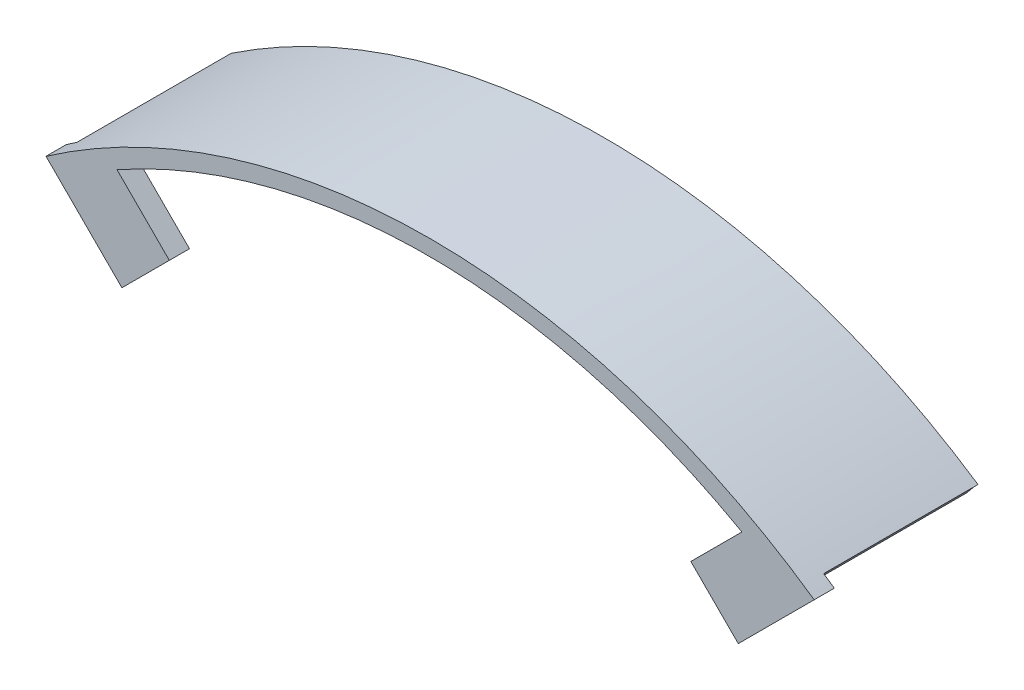
from build123d import *

# Parameters (mm, degrees)
CROQUIS1_R              = 100
SALIENTE_EXTRUIR1_DEPTH = 3
CROQUIS3_R              = 110
CORTAR_EXTRUIR1_DEPTH   = 3
REDONDEO1_R             = 10
CORTAR_EXTRUIR6_DEPTH   = 10
CROQUIS12_R             = 1.5
CORTAR_EXTRUIR7_DEPTH   = 142.453172607
CROQUIS9_R              = 1.5
CROQUIS9_W              = 4.5
CROQUIS9_H              = 8
CROQUIS9_W_2            = 8
CROQUIS9_H_2            = 4.5
CORTAR_EXTRUIR5_DEPTH   = 10
CORTAR_EXTRUIR9_DEPTH   = 142.453172607
SALIENTE_EXTRUIR3_START = -3
SALIENTE_EXTRUIR3_DEPTH = 3
SALIENTE_EXTRUIR4_DEPTH = 23
CORTAR_EXTRUIR10_DEPTH  = 119.122839627
CORTAR_EXTRUIR11_DEPTH  = 23
CORTAR_EXTRUIR14_DEPTH  = 23


with BuildPart() as part:
    # Croquis1 → Saliente-Extruir1 (new body)
    with BuildSketch(Plane.XY):
        Circle(CROQUIS1_R)
    extrude(amount=SALIENTE_EXTRUIR1_DEPTH)

    # Croquis3 → Cortar-Extruir1 (cut)
    with BuildSketch(Plane.XY.offset(3)):
        with Locations((190, 0)):
            Circle(CROQUIS3_R)
    extrude(amount=-CORTAR_EXTRUIR1_DEPTH, mode=Mode.SUBTRACT)

    # Redondeo1
    redondeo1_edges = [part.edges().sort_by_distance(p)[0] for p in [
        (89.473684211, -44.659375654, 1.5),
        (89.473684211, 44.659375654, 1.5),
    ]]
    fillet(redondeo1_edges, radius=REDONDEO1_R)

    # Croquis5 → Cortar-Extruir6 (cut)
    with BuildSketch(Plane.XY.offset(3)):
        Polygon((-58.336309448, -83.085046789), (-83.085046789, -58.336309448), (-65.40737726, -40.658639918), (-40.658639918, -65.40737726), align=None)
        Polygon((-83.085046789, 58.336309448), (-58.336309448, 83.085046789), (-40.658639918, 65.40737726), (-65.40737726, 40.658639918), align=None)
        Polygon((58.336309448, -83.085046789), (83.085046789, -58.336309448), (65.40737726, -40.658639918), (40.658639918, -65.40737726), align=None)
        Polygon((58.336309448, 83.085046789), (83.085046789, 58.336309448), (65.40737726, 40.658639918), (40.658639918, 65.40737726), align=None)
    extrude(amount=-CORTAR_EXTRUIR6_DEPTH, mode=Mode.SUBTRACT)

    # Croquis12 → Cortar-Extruir7 (cut, through all)
    with BuildSketch(Plane.XY.offset(3)):
        with Locations((-63.604254904, -36.804908024)):
            Circle(CROQUIS12_R)
        with Locations((-36.804907897, -63.604255031)):
            Circle(CROQUIS12_R)
        with Locations((-47.666068056, -20.866721176)):
            Circle(CROQUIS12_R)
        with Locations((-20.866721049, -47.666068183)):
            Circle(CROQUIS12_R)
        with Locations((47.666068183, 20.866721049)):
            Circle(CROQUIS12_R)
        with Locations((20.866721176, 47.666068056)):
            Circle(CROQUIS12_R)
        with Locations((63.604255031, 36.804907897)):
            Circle(CROQUIS12_R)
        with Locations((36.804908024, 63.604254904)):
            Circle(CROQUIS12_R)
        with Locations((20.866721325, -47.666067908)):
            Circle(CROQUIS12_R)
        with Locations((47.666068332, -20.866720901)):
            Circle(CROQUIS12_R)
        with Locations((63.60425518, -36.804907749)):
            Circle(CROQUIS12_R)
        with Locations((36.804908173, -63.604254756)):
            Circle(CROQUIS12_R)
        with Locations((-63.604254756, 36.804908173)):
            Circle(CROQUIS12_R)
        with Locations((-36.804907749, 63.60425518)):
            Circle(CROQUIS12_R)
        with Locations((-20.866720901, 47.666068332)):
            Circle(CROQUIS12_R)
        with Locations((-47.666067908, 20.866721325)):
            Circle(CROQUIS12_R)
    extrude(amount=-CORTAR_EXTRUIR7_DEPTH, mode=Mode.SUBTRACT)

    # Croquis9 → Cortar-Extruir5 (cut)
    with BuildSketch(Plane.XY.offset(3)):
        with Locations((71.9, -4)):
            Circle(CROQUIS9_R)
        with Locations((35.959143483, 4)):
            Circle(CROQUIS9_R)
        with Locations((71.959143483, 4)):
            Circle(CROQUIS9_R)
        with Locations((35.9, -4)):
            Circle(CROQUIS9_R)
        with Locations((-91.190074744, 4)):
            Circle(CROQUIS9_R)
        with Locations((-91.190074744, -4)):
            Circle(CROQUIS9_R)
        with Locations((-55.190074744, 4)):
            Circle(CROQUIS9_R)
        with Locations((-55.190074744, -4)):
            Circle(CROQUIS9_R)
        with Locations((-4, 85)):
            Circle(CROQUIS9_R)
        with Locations((4, 85)):
            Circle(CROQUIS9_R)
        with Locations((-4, 49)):
            Circle(CROQUIS9_R)
        with Locations((4, 49)):
            Circle(CROQUIS9_R)
        with Locations((-4, -49)):
            Circle(CROQUIS9_R)
        with Locations((4, -49)):
            Circle(CROQUIS9_R)
        with Locations((4, -85)):
            Circle(CROQUIS9_R)
        with Locations((-4, -85)):
            Circle(CROQUIS9_R)
        with Locations((41.209143483, 0)):
            Rectangle(CROQUIS9_W, CROQUIS9_H)
        with Locations((0, -54.25)):
            Rectangle(CROQUIS9_W_2, CROQUIS9_H_2)
        with Locations((-60.440074744, 0)):
            Rectangle(CROQUIS9_W, CROQUIS9_H)
        with Locations((0, 54.25)):
            Rectangle(CROQUIS9_W_2, CROQUIS9_H_2)
    extrude(amount=-CORTAR_EXTRUIR5_DEPTH, mode=Mode.SUBTRACT)

    # Croquis13 → Cortar-Extruir9 (cut, through all)
    with BuildSketch(Plane.XY.offset(3)):
        with BuildLine():
            Line((-53.709599002, 78.458336343), (-40.658639918, 65.40737726))
            Line((-40.658639918, 65.40737726), (-65.40737726, 40.658639918))
            Line((-65.40737726, 40.658639918), (-81.993870249, 57.245132907))
            ThreePointArc((-81.993870249, 57.245132907), (-100, 0), (-81.993870249, -57.245132907))
            Line((-81.993870249, -57.245132907), (-65.40737726, -40.658639918))
            Line((-65.40737726, -40.658639918), (-40.658639918, -65.40737726))
            Line((-40.658639918, -65.40737726), (-57.245132907, -81.993870249))
            ThreePointArc((-57.245132907, -81.993870249), (0, -100), (57.245132907, -81.993870249))
            Line((57.245132907, -81.993870249), (40.658639918, -65.40737726))
            Line((40.658639918, -65.40737726), (65.40737726, -40.658639918))
            Line((65.40737726, -40.658639918), (81.993870249, -57.245132907))
            ThreePointArc((81.993870249, -57.245132907), (90.456214357, -50.775094972), (87.719298246, -40.480341508))
            ThreePointArc((87.719298246, -40.480341508), (80, 0), (87.719298246, 40.480341508))
            ThreePointArc((87.719298246, 40.480341508), (93.238979947, 51.725451206), (81.993870249, 57.245132907))
            Line((81.993870249, 57.245132907), (65.40737726, 40.658639918))
            Line((65.40737726, 40.658639918), (40.658639918, 65.40737726))
            Line((40.658639918, 65.40737726), (53.489520931, 78.238258273))
            ThreePointArc((53.489520931, 78.238258273), (-0.076031766, 94.913097691), (-53.709599002, 78.458336343))
        make_face()
    extrude(amount=-CORTAR_EXTRUIR9_DEPTH, mode=Mode.SUBTRACT)

    # Croquis14 → Saliente-Extruir3 (add)
    with BuildSketch(Plane(origin=(0, 0, 0), x_dir=(-1, 0, 0), z_dir=(0, 0, -1)).offset(SALIENTE_EXTRUIR3_START)):
        with BuildLine():
            Line((45.931424408, 70.68016175), (38.860356597, 77.751229562))
            Line((38.860356597, 77.751229562), (44.891480587, 83.782353552))
            ThreePointArc((44.891480587, 83.782353552), (49.372752226, 81.239949702), (53.709599002, 78.458336343))
            Line((53.709599002, 78.458336343), (45.931424408, 70.68016175))
        make_face()
        with BuildLine():
            Line((-45.931424408, 70.68016175), (-38.860356597, 77.751229562))
            Line((-38.860356597, 77.751229562), (-44.702591339, 83.593464304))
            ThreePointArc((-44.702591339, 83.593464304), (-49.168617514, 81.034921456), (-53.489520931, 78.238258273))
            Line((-53.489520931, 78.238258273), (-45.931424408, 70.68016175))
        make_face()
    extrude(amount=SALIENTE_EXTRUIR3_DEPTH)

    # Croquis15 → Saliente-Extruir4 (add)
    with BuildSketch(Plane.XY.offset(3)):
        with BuildLine():
            Line((57.245132907, 81.993870249), (45.931424408, 70.68016175))
            Line((45.931424408, 70.68016175), (38.860356597, 77.751229562))
            Line((38.860356597, 77.751229562), (44.702591339, 83.593464304))
            ThreePointArc((44.702591339, 83.593464304), (-0.070778824, 94.913086762), (-44.891480587, 83.782353552))
            Line((-44.891480587, 83.782353552), (-38.860356597, 77.751229562))
            Line((-38.860356597, 77.751229562), (-45.931424408, 70.68016175))
            Line((-45.931424408, 70.68016175), (-57.245132907, 81.993870249))
            ThreePointArc((-57.245132907, 81.993870249), (0, 100), (57.245132907, 81.993870249))
        make_face()
    extrude(amount=SALIENTE_EXTRUIR4_DEPTH)

    # Croquis16 → Cortar-Extruir10 (cut, through all)
    with BuildSketch(Plane(origin=(0, 0, 0), x_dir=(-1, 0, 0), z_dir=(0, 0, -1))):
        with BuildLine():
            Line((-44.702591339, 83.593464304), (-46.470358292, 85.361231257))
            ThreePointArc((-46.470358292, 85.361231257), (0.069710797, 97.650396076), (46.65924754, 85.550120505))
            Line((46.65924754, 85.550120505), (44.891480587, 83.782353552))
            ThreePointArc((44.891480587, 83.782353552), (0.070778824, 94.913086762), (-44.702591339, 83.593464304))
        make_face()
    extrude(amount=-CORTAR_EXTRUIR10_DEPTH, mode=Mode.SUBTRACT)

    # Croquis17 → Cortar-Extruir11 (cut)
    with BuildSketch(Plane(origin=(0, 0, 0), x_dir=(-1, 0, 0), z_dir=(0, 0, -1))):
        Polygon((-45.931424408, 70.68016175), (-55.477365954, 80.226103296), (-46.470358292, 85.361231257), (-38.860356597, 77.751229562), align=None)
        Polygon((46.65924754, 85.550120505), (38.860356597, 77.751229562), (45.931424408, 70.68016175), (55.477365954, 80.226103296), align=None)
    extrude(amount=-CORTAR_EXTRUIR11_DEPTH, mode=Mode.SUBTRACT)

    # Croquis20 → Cortar-Extruir14 (cut)
    with BuildSketch(Plane(origin=(0, 0, 0), x_dir=(-1, 0, 0), z_dir=(0, 0, -1))):
        with BuildLine():
            Line((57.245132907, 81.993870249), (55.477365954, 80.226103296))
            ThreePointArc((55.477365954, 80.226103296), (54.40334919, 80.386124061), (53.761558746, 81.262037118))
            Line((53.761558746, 81.262037118), (55.557141199, 83.059809274))
            ThreePointArc((55.557141199, 83.059809274), (56.621900253, 82.876434291), (57.245132907, 81.993870249))
        make_face()
        with BuildLine():
            Line((-57.245132907, 81.993870249), (-55.477365954, 80.226103296))
            ThreePointArc((-55.477365954, 80.226103296), (-54.519142467, 80.346961085), (-53.927035504, 81.109986773))
            Line((-53.927035504, 81.109986773), (-55.553473978, 83.059809274))
            ThreePointArc((-55.553473978, 83.059809274), (-56.620066643, 82.877193797), (-57.245132907, 81.993870249))
        make_face()
    extrude(amount=-CORTAR_EXTRUIR14_DEPTH, mode=Mode.SUBTRACT)


solid = part.part
